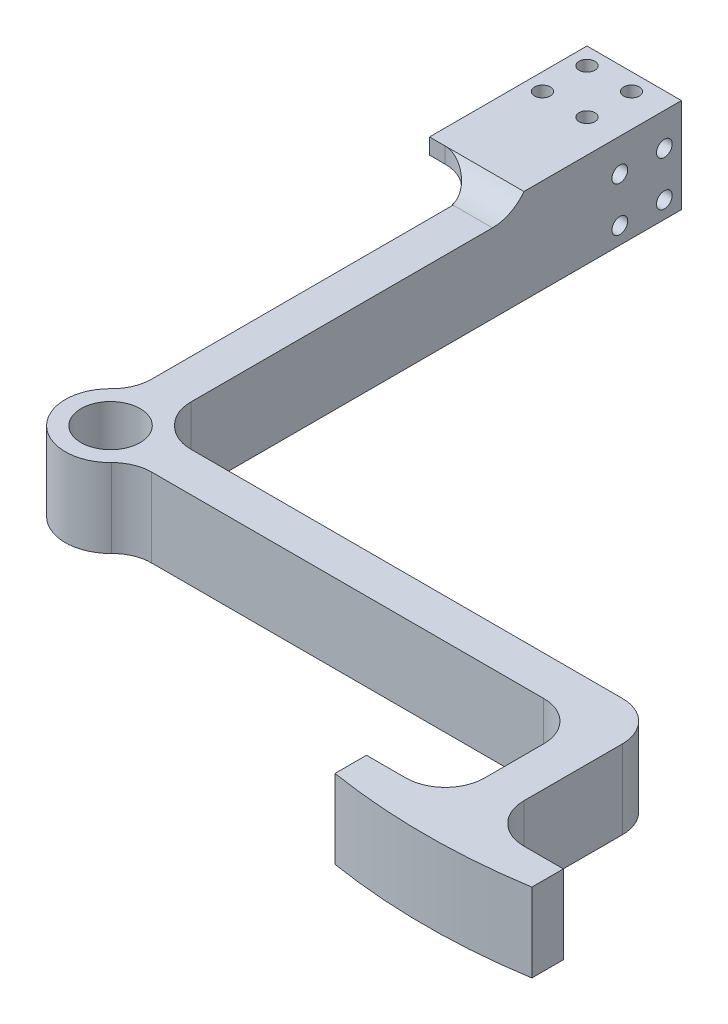
from build123d import *

# Parameters (mm, degrees)
SKETCH1_R           = 7.5
BOSS_EXTRUDE1_DEPTH = 20
CUT_EXTRUDE1_REACH  = 208.155
SKETCH2_R           = 2
FILLET1_R           = 10
SKETCH3_W           = 40
SKETCH3_H           = 4
BOSS_EXTRUDE2_DEPTH = 24
CUT_EXTRUDE2_REACH  = 212.24
SKETCH4_R           = 2
FILLET3_R           = 10
FILLET4_START       = -5.202040929
FILLET4_DEPTH       = 6.202040929
FILLET4_START_2     = -14.898418687
FILLET4_2_DEPTH     = 9.696377758
FILLET4_START_3     = 20
FILLET4_3_DEPTH     = 5


with BuildPart() as part:
    # Sketch1 → Boss-Extrude1 (new body)
    with BuildSketch(Plane(origin=(0, 0, 0), x_dir=(1, 0, 0), z_dir=(0, 1, 0))):
        with BuildLine():
            Line((10.356157589, -5), (125, -5))
            Line((125, -5), (125, -40))
            Line((125, -40), (105, -40))
            Line((105, -40), (105, -48))
            ThreePointArc((105, -48), (130, -50), (155, -48))
            Line((155, -48), (155, -40))
            Line((155, -40), (135, -40))
            Line((135, -40), (135, 5))
            Line((135, 5), (10.356157589, 5))
            ThreePointArc((10.356157589, 5), (8.131727984, 8.131727984), (5, 10.356157589))
            Line((5, 10.356157589), (5, 140))
            Line((5, 140), (1, 140))
            Line((1, 140), (1, 110))
            Line((1, 110), (-5, 110))
            Line((-5, 110), (-5, 10.356157589))
            ThreePointArc((-5, 10.356157589), (-8.131727984, -8.131727984), (10.356157589, -5))
        make_face()
        with Locations(Location((0, 0, 0), (0, 0, 270))):
            Circle(SKETCH1_R, mode=Mode.SUBTRACT)
    extrude(amount=BOSS_EXTRUDE1_DEPTH)

    # Sketch2 → Cut-Extrude1 (cut, up to next)
    with BuildSketch(Plane(origin=(5, 0, 0), x_dir=(0, 0, -1), z_dir=(1, 0, 0)), mode=Mode.PRIVATE) as cut_extrude1_sk1:
        with Locations((135.656854249, 4.343145751)):
            Circle(SKETCH2_R)
    cut_extrude1_tool1 = extrude(cut_extrude1_sk1.sketch, amount=-CUT_EXTRUDE1_REACH, mode=Mode.PRIVATE) & part.part
    # Sketch2 → Cut-Extrude1 (cut, up to next)
    with BuildSketch(Plane(origin=(5, 0, 0), x_dir=(0, 0, -1), z_dir=(1, 0, 0)), mode=Mode.PRIVATE) as cut_extrude1_sk2:
        with Locations((124.343145751, 4.343145751)):
            Circle(SKETCH2_R)
    cut_extrude1_tool2 = extrude(cut_extrude1_sk2.sketch, amount=-CUT_EXTRUDE1_REACH, mode=Mode.PRIVATE) & part.part
    # Sketch2 → Cut-Extrude1 (cut, up to next)
    with BuildSketch(Plane(origin=(5, 0, 0), x_dir=(0, 0, -1), z_dir=(1, 0, 0)), mode=Mode.PRIVATE) as cut_extrude1_sk3:
        with Locations((124.343145751, 15.656854249)):
            Circle(SKETCH2_R)
    cut_extrude1_tool3 = extrude(cut_extrude1_sk3.sketch, amount=-CUT_EXTRUDE1_REACH, mode=Mode.PRIVATE) & part.part
    # Sketch2 → Cut-Extrude1 (cut, up to next)
    with BuildSketch(Plane(origin=(5, 0, 0), x_dir=(0, 0, -1), z_dir=(1, 0, 0)), mode=Mode.PRIVATE) as cut_extrude1_sk4:
        with Locations((135.656854249, 15.656854249)):
            Circle(SKETCH2_R)
    cut_extrude1_tool4 = extrude(cut_extrude1_sk4.sketch, amount=-CUT_EXTRUDE1_REACH, mode=Mode.PRIVATE) & part.part
    add(cut_extrude1_tool1.solids().sort_by_distance((5, 4.343146, -135.656854))[0], mode=Mode.SUBTRACT)
    add(cut_extrude1_tool2.solids().sort_by_distance((5, 4.343146, -124.343146))[0], mode=Mode.SUBTRACT)
    add(cut_extrude1_tool3.solids().sort_by_distance((5, 15.656854, -124.343146))[0], mode=Mode.SUBTRACT)
    add(cut_extrude1_tool4.solids().sort_by_distance((5, 15.656854, -135.656854))[0], mode=Mode.SUBTRACT)

    # Fillet1
    # the kernel refuses this fillet: 10 mm, written as the material it adds along each edge
    with BuildSketch(Plane(origin=(1, 0, -110), x_dir=(0, 0, -1), z_dir=(0, 1, 0))) as fillet1_piece_1:
        with BuildLine():
            CenterArc((9.16515139, 10), FILLET1_R, 203.578178478, 66.421821522)
            Line((0, 6), (0, 0))
            Line((0, 0), (9.16515139, 0))
        make_face()
    extrude(amount=20)
    with BuildSketch(Plane(origin=(125, 0, 40), x_dir=(0, 0, -1), z_dir=(0, 1, 0)), Plane(origin=(135, 0, 40), x_dir=(1, 0, 0), z_dir=(0, 1, 0)), Plane(origin=(125, 0, 5), x_dir=(-1, 0, 0), z_dir=(0, 1, 0))) as fillet1_piece_2:
        with BuildLine():
            CenterArc((FILLET1_R, FILLET1_R), FILLET1_R, 180, 90)
            Line((0, FILLET1_R), (0, 0))
            Line((0, 0), (FILLET1_R, 0))
        make_face()
    extrude(amount=20)
    with BuildSketch(Plane(origin=(10.356157589, 0, 5), x_dir=(1, 0, 0), z_dir=(0, 1, 0))) as fillet1_piece_3:
        with BuildLine():
            CenterArc((5.046764212, -10), FILLET1_R, 90, 45.75928121)
            ThreePointArc((-2.117385463, -3.023255814), (-0.936610269, -1.597130308), (0, 0))
            Line((0, 0), (5.046764212, 0))
        make_face()
    extrude(amount=20)
    with BuildSketch(Plane(origin=(10.356157589, 0, -5), x_dir=(1, 0, 0), z_dir=(0, 1, 0))) as fillet1_piece_4:
        with BuildLine():
            CenterArc((5.046764212, 10), FILLET1_R, 224.24071879, 45.75928121)
            ThreePointArc((-2.117385463, 3.023255814), (-0.936610269, 1.597130308), (0, 0))
            Line((0, 0), (5.046764212, 0))
        make_face()
    extrude(amount=20)
    with BuildSketch(Plane(origin=(5, 0, -10.356157589), x_dir=(0.8190910712491061, 0, 0.5736635050271124), z_dir=(0, 1, 0))) as fillet1_piece_5:
        with BuildLine():
            CenterArc((5.295766266, 9.870394555), FILLET1_R, 215.006090265, 45.75928121)
            Line((-2.895144447, 4.133759505), (0, 0))
            ThreePointArc((0, 0), (1.845494305, 0.149046262), (3.690988609, 0))
        make_face()
    extrude(amount=20)
    with BuildSketch(Plane(origin=(-5, 0, -10.356157589), x_dir=(-0.8190910712491065, 0, 0.5736635050271119), z_dir=(0, 1, 0))) as fillet1_piece_6:
        with BuildLine():
            CenterArc((5.295766266, -9.870394555), FILLET1_R, 99.234628525, 45.75928121)
            Line((-2.895144447, -4.133759505), (0, 0))
            ThreePointArc((0, 0), (1.845494305, -0.149046262), (3.690988609, 0))
        make_face()
    extrude(amount=20)
    # the kernel refuses this fillet: 10 mm, written as the material it takes off along each edge
    with BuildSketch(Plane(origin=(135, -25, -5), x_dir=(0, 0, 1), z_dir=(0, 1, 0))) as fillet1_2_piece_1:
        with BuildLine():
            CenterArc((FILLET1_R, -FILLET1_R), FILLET1_R, 90, 90)
            Line((0, -FILLET1_R), (0, 0))
            Line((0, 0), (FILLET1_R, 0))
        make_face()
    extrude(amount=70, mode=Mode.SUBTRACT)

    # Sketch3 → Boss-Extrude2 (add)
    with BuildSketch(Plane(origin=(5, 0, 0), x_dir=(0, 0, -1), z_dir=(1, 0, 0))):
        with Locations((120, 22)):
            Rectangle(SKETCH3_W, SKETCH3_H)
    extrude(amount=-BOSS_EXTRUDE2_DEPTH)

    # Sketch4 → Cut-Extrude2 (cut, up to next)
    with BuildSketch(Plane(origin=(0, 24, 0), x_dir=(1, 0, 0), z_dir=(0, 1, 0)), mode=Mode.PRIVATE) as cut_extrude2_sk1:
        with Locations(Location((-3.343145751, 135.656854249, 0), (0, 0, 270))):
            Circle(SKETCH4_R)
    cut_extrude2_tool1 = extrude(cut_extrude2_sk1.sketch, amount=-CUT_EXTRUDE2_REACH, mode=Mode.PRIVATE) & part.part
    # Sketch4 → Cut-Extrude2 (cut, up to next)
    with BuildSketch(Plane(origin=(0, 24, 0), x_dir=(1, 0, 0), z_dir=(0, 1, 0)), mode=Mode.PRIVATE) as cut_extrude2_sk2:
        with Locations(Location((-14.656854249, 135.656854249, 0), (0, 0, 270))):
            Circle(SKETCH4_R)
    cut_extrude2_tool2 = extrude(cut_extrude2_sk2.sketch, amount=-CUT_EXTRUDE2_REACH, mode=Mode.PRIVATE) & part.part
    # Sketch4 → Cut-Extrude2 (cut, up to next)
    with BuildSketch(Plane(origin=(0, 24, 0), x_dir=(1, 0, 0), z_dir=(0, 1, 0)), mode=Mode.PRIVATE) as cut_extrude2_sk3:
        with Locations(Location((-14.656854249, 124.343145751, 0), (0, 0, 270))):
            Circle(SKETCH4_R)
    cut_extrude2_tool3 = extrude(cut_extrude2_sk3.sketch, amount=-CUT_EXTRUDE2_REACH, mode=Mode.PRIVATE) & part.part
    # Sketch4 → Cut-Extrude2 (cut, up to next)
    with BuildSketch(Plane(origin=(0, 24, 0), x_dir=(1, 0, 0), z_dir=(0, 1, 0)), mode=Mode.PRIVATE) as cut_extrude2_sk4:
        with Locations(Location((-3.343145751, 124.343145751, 0), (0, 0, 270))):
            Circle(SKETCH4_R)
    cut_extrude2_tool4 = extrude(cut_extrude2_sk4.sketch, amount=-CUT_EXTRUDE2_REACH, mode=Mode.PRIVATE) & part.part
    add(cut_extrude2_tool1.solids().sort_by_distance((-3.343146, 24, -135.656854))[0], mode=Mode.SUBTRACT)
    add(cut_extrude2_tool2.solids().sort_by_distance((-14.656854, 24, -135.656854))[0], mode=Mode.SUBTRACT)
    add(cut_extrude2_tool3.solids().sort_by_distance((-14.656854, 24, -124.343146))[0], mode=Mode.SUBTRACT)
    add(cut_extrude2_tool4.solids().sort_by_distance((-3.343146, 24, -124.343146))[0], mode=Mode.SUBTRACT)

    # Fillet3
    # the kernel refuses this fillet: 10 mm, written as the material it adds along each edge
    with BuildSketch(Plane(origin=(5, 20, -100), x_dir=(0, 0, 1), z_dir=(-1, 0, 0))) as fillet3_piece_1:
        with BuildLine():
            CenterArc((8, 10), FILLET3_R, 216.869897646, 53.130102354)
            Line((0, 4), (0, 0))
            Line((0, 0), (8, 0))
        make_face()
    extrude(amount=10)

    # Fillet4: read off the stored shape, not the designer's step
    # Fillet4 outline → Fillet4 (add)
    with BuildSketch(Plane.YZ.offset(FILLET4_START)):
        with BuildLine():
            Line((20, -92), (20, -100))
            Line((20, -100), (24.000002869, -100.000002152))
            ThreePointArc((24.000002869, -100.000002152), (21.055728892, -96.472137559), (20, -92))
        make_face()
    extrude(amount=FILLET4_DEPTH)

    # Fillet4 2 outline → Fillet4 2 (add)
    with BuildSketch(Plane.YZ.offset(FILLET4_START_2)):
        with BuildLine():
            ThreePointArc((24.000002869, -100.000002152), (21.055728892, -96.472137559), (20, -92))
            Line((20, -92), (20, -100))
            Line((20, -100), (24.000002869, -100.000002152))
        make_face()
    extrude(amount=FILLET4_2_DEPTH)

    # Fillet4 3 outline → Fillet4 3 (cut)
    with BuildSketch(Plane(origin=(0, 0, 0), x_dir=(1, 0, 0), z_dir=(0, 1, 0)).offset(FILLET4_START_3)):
        with BuildLine():
            Line((-4.793792738, 90), (-5.202041029, 92))
            ThreePointArc((-5.202041029, 92), (-8.636183479, 97.713743532), (-14.898418687, 99.999484049))
            Line((-14.898418687, 99.999484049), (-14.898418687, 90))
            Line((-14.898418687, 90), (-4.793792738, 90))
        make_face()
    extrude(amount=FILLET4_3_DEPTH, mode=Mode.SUBTRACT)


solid = part.part
